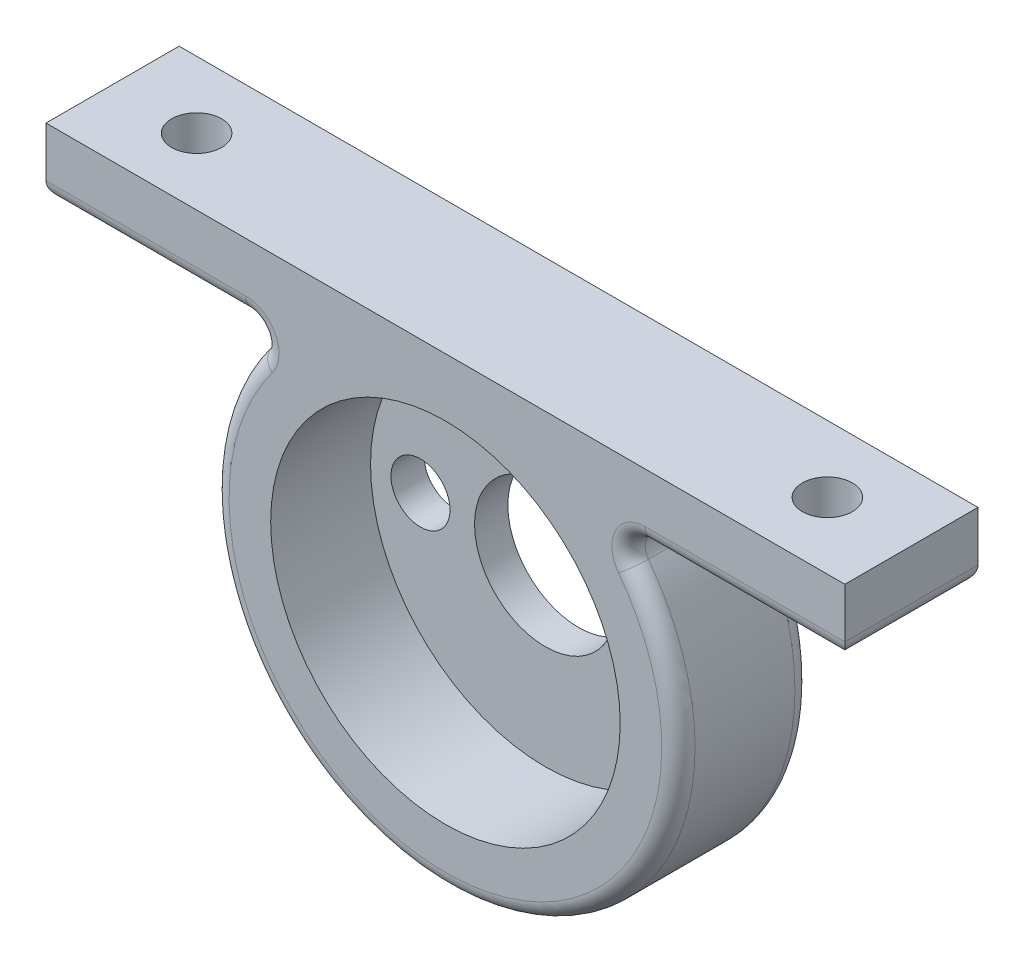
from build123d import *

# Parameters (mm, degrees)
SALIENTE_EXTRUIR1_DEPTH = 8
REDONDEO1_R             = 1
CROQUIS2_R              = 1.5
CORTAR_EXTRUIR1_DEPTH   = 35.871191617
CROQUIS3_R              = 10.5
CORTAR_EXTRUIR2_DEPTH   = 6
CROQUIS4_R              = 4.25
CROQUIS4_R_2            = 1.775
CORTAR_EXTRUIR3_DEPTH   = 29.913664638


with BuildPart() as part:
    # Croquis1 → Saliente-Extruir1 (new body)
    with BuildSketch(Plane.XY):
        with BuildLine():
            Line((0, 14), (24, 14))
            Line((24, 14), (24, 10))
            Line((24, 10), (9.797958971, 10))
            ThreePointArc((9.797958971, 10), (0, -14), (-9.797958971, 10))
            Line((-9.797958971, 10), (-24, 10))
            Line((-24, 10), (-24, 14))
            Line((-24, 14), (0, 14))
        make_face()
    extrude(amount=SALIENTE_EXTRUIR1_DEPTH)

    # Redondeo1
    redondeo1_edges = [part.edges().sort_by_distance(p)[0] for p in [
        (-16.898979486, 10, 8),
        (-16.898979486, 10, 0),
        (16.898979486, 10, 8),
        (16.898979486, 10, 0),
        (-9.797958971, 10, 4),
        (0, -14, 8),
        (9.797958971, 10, 4),
        (0, -14, 0),
        (24, 10, 4),
        (-24, 10, 4),
    ]]
    fillet(redondeo1_edges, radius=REDONDEO1_R)

    # Croquis2 → Cortar-Extruir1 (cut, through all)
    with BuildSketch(Plane.XZ.offset(-10)):
        with Locations((-18.949489743, 4)):
            Circle(CROQUIS2_R)
        with Locations((18.949489743, 4)):
            Circle(CROQUIS2_R)
    extrude(amount=-CORTAR_EXTRUIR1_DEPTH, mode=Mode.SUBTRACT)

    # Croquis3 → Cortar-Extruir2 (cut)
    with BuildSketch(Plane.XY.offset(8)):
        Circle(CROQUIS3_R)
    extrude(amount=-CORTAR_EXTRUIR2_DEPTH, mode=Mode.SUBTRACT)

    # Croquis4 → Cortar-Extruir3 (cut, through all)
    with BuildSketch(Plane(origin=(0, 0, 0), x_dir=(-1, 0, 0), z_dir=(0, 0, -1))):
        Circle(CROQUIS4_R)
        with Locations((7.5, 0)):
            Circle(CROQUIS4_R_2)
        with Locations((-7.5, 0)):
            Circle(CROQUIS4_R_2)
    extrude(amount=-CORTAR_EXTRUIR3_DEPTH, mode=Mode.SUBTRACT)


solid = part.part
